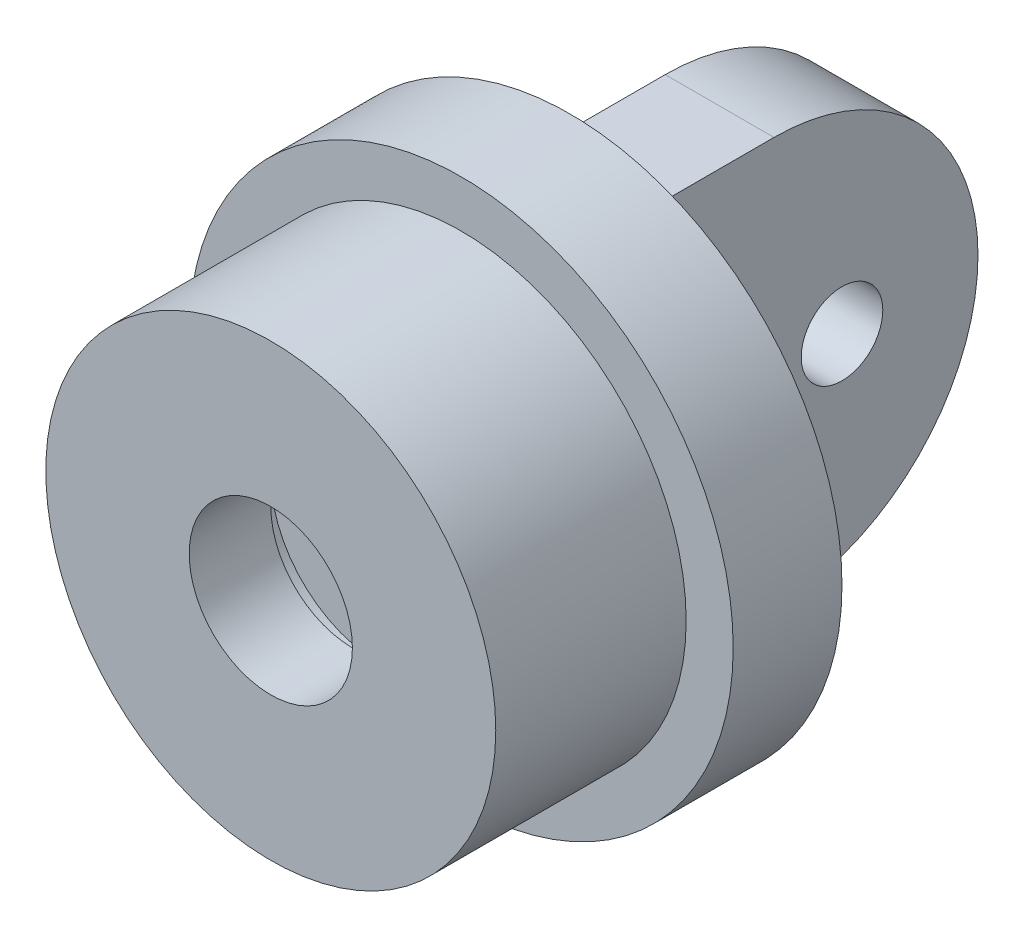
from build123d import *

# Parameters (mm, degrees)
SKETCH1_R           = 50
BOSS_EXTRUDE1_DEPTH = 20
SKETCH2_W           = 20
SKETCH2_H           = 75
BOSS_EXTRUDE2_DEPTH = 65
SKETCH3_R           = 7.5
CUT_EXTRUDE1_DEPTH  = 65
FILLET1_R           = 37.5
SKETCH4_R           = 41.355609665
BOSS_EXTRUDE3_DEPTH = 35
SKETCH8_R           = 15
CUT_EXTRUDE2_DEPTH  = 20
SKETCH10_W          = 5
SKETCH10_H          = 8.446283525


with BuildPart() as part:
    # Sketch1 → Boss-Extrude1 (new body)
    with BuildSketch(Plane.XY):
        Circle(SKETCH1_R)
    extrude(amount=BOSS_EXTRUDE1_DEPTH)

    # Sketch2 → Boss-Extrude2 (add)
    with BuildSketch(Plane(origin=(0, 0, 0), x_dir=(-1, 0, 0), z_dir=(0, 0, -1))):
        Rectangle(SKETCH2_W, SKETCH2_H)
    extrude(amount=BOSS_EXTRUDE2_DEPTH)

    # Sketch3 → Cut-Extrude1 (cut)
    with BuildSketch(Plane(origin=(10, 0, 0), x_dir=(0, 0, -1), z_dir=(1, 0, 0))):
        with Locations((39.996807152, 0)):
            Circle(SKETCH3_R)
    extrude(amount=-CUT_EXTRUDE1_DEPTH, mode=Mode.SUBTRACT)

    # Fillet1
    fillet1_edges = [part.edges().sort_by_distance(p)[0] for p in [
        (0, -37.5, -65),
        (0, 37.5, -65),
    ]]
    fillet(fillet1_edges, radius=FILLET1_R - 0.0001)  # a hair under: the kernel refuses the full size

    # Sketch4 → Boss-Extrude3 (add)
    with BuildSketch(Plane.XY.offset(20)):
        Circle(SKETCH4_R)
    extrude(amount=BOSS_EXTRUDE3_DEPTH)

    # Sketch8 → Cut-Extrude2 (cut)
    with BuildSketch(Plane.XY.offset(55)):
        Circle(SKETCH8_R)
    extrude(amount=-CUT_EXTRUDE2_DEPTH, mode=Mode.SUBTRACT)

    # Sketch10 → Cut-Revolve1 (revolve, cut)
    with BuildSketch(Plane(origin=(0, 0, 0), x_dir=(0, 0, -1), z_dir=(1, 0, 0)), mode=Mode.PRIVATE) as cut_revolve1_sk:
        with Locations((-37.5, 15.776858238)):
            Rectangle(SKETCH10_W, SKETCH10_H)
    revolve(cut_revolve1_sk.sketch.rotate(Axis((0, 0, 55), (0, 0, -1)), 90), axis=Axis((0, 0, 55), (0, 0, -1)), mode=Mode.SUBTRACT)


solid = part.part
